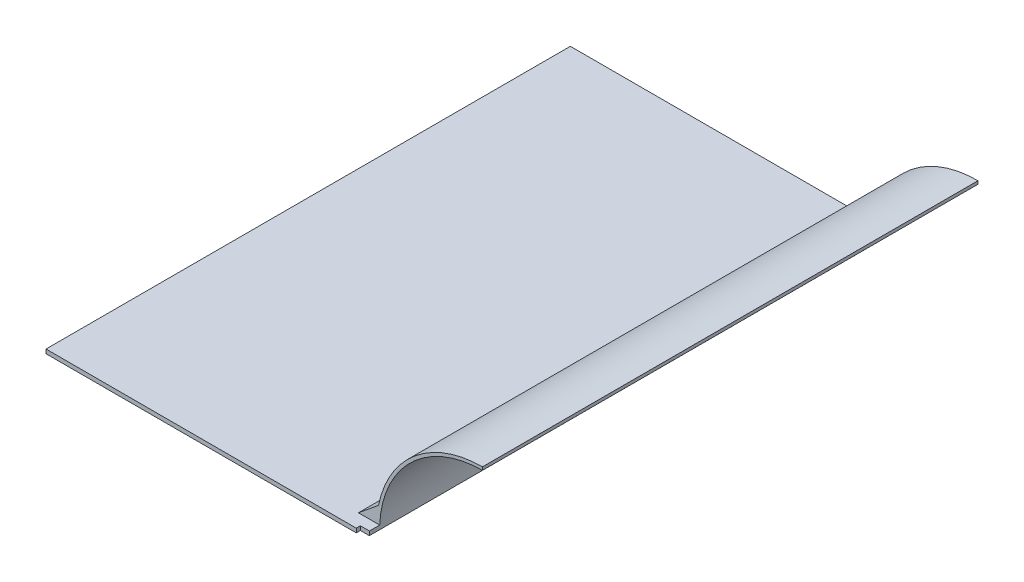
from build123d import *

# Parameters (mm, degrees)
BOSS_EXTRUDE1_DEPTH = 122.5
BOSS_EXTRUDE2_DEPTH = 5
FILLET1_R           = 0.6
BOSS_EXTRUDE3_DEPTH = 5
SKETCH6_W           = 154.900501524
SKETCH6_H           = 4.066396164
BOSS_EXTRUDE4_DEPTH = 5
CUT_EXTRUDE1_START  = -4
CUT_EXTRUDE1_DEPTH  = 4
BOSS_EXTRUDE5_START = 1
BOSS_EXTRUDE5_DEPTH = 1
SKETCH10_W          = 4
SKETCH10_H          = 2
CUT_EXTRUDE2_DEPTH  = 10
CUT_EXTRUDE3_DEPTH  = 1.066396
CUT_EXTRUDE5_DEPTH  = 1
CHAMFER1_START      = -123.5
CHAMFER1_DEPTH      = 247
SKETCH18_W          = 76.155383
SKETCH18_H          = 7
SKETCH18_W_2        = 77.788835
CUT_EXTRUDE6_DEPTH  = 60
BOSS_EXTRUDE6_START = 2
BOSS_EXTRUDE6_DEPTH = 2


with BuildPart() as part:
    # Sketch1 → Boss-Extrude1 (new, symmetric)
    with BuildSketch(Plane.XY):
        with BuildLine():
            Line((76.956830849, 0), (-76.956830849, 0))
            Line((-76.956830849, 0), (-76.956830849, -4.066396164))
            Line((-76.956830849, -4.066396164), (78.296976713, -4.066396164))
            ThreePointArc((78.296976713, -4.066396164), (92.937456554, 31.296585381), (128.296975316, 45.945426519))
            Line((128.296975316, 45.945426519), (128.296975316, 47.445426519))
            ThreePointArc((128.296975316, 47.445426519), (93.343867688, 33.767777941), (76.956830849, 0))
        make_face()
    extrude(amount=BOSS_EXTRUDE1_DEPTH, both=True)

    # Sketch4 → Boss-Extrude2 (add, symmetric)
    with BuildSketch(Plane.XY):
        Polygon((-75.056329325, -5), (-72.325824204, -5), (-71.690241182, -6.74625), (-71.191912346, -6.74625), (-70.556329325, -5), (-69.825824204, -5), (-69.190241182, -6.74625), (-68.691912346, -6.74625), (-68.056329325, -5), (-67.325824204, -5), (-66.690241182, -6.74625), (-66.191912346, -6.74625), (-65.556329325, -5), (-64.825824204, -5), (-64.190241182, -6.74625), (-63.691912346, -6.74625), (-63.056329325, -5), (-62.325824204, -5), (-61.690241182, -6.74625), (-61.191912346, -6.74625), (-60.556329325, -5), (-59.825824204, -5), (-59.190241182, -6.74625), (-58.691912346, -6.74625), (-58.056329325, -5), (-57.325824204, -5), (-56.690241182, -6.74625), (-56.191912346, -6.74625), (-55.556329325, -5), (-54.825824204, -5), (-54.190241182, -6.74625), (-53.691912346, -6.74625), (-53.056329325, -5), (-52.325824204, -5), (-51.690241182, -6.74625), (-51.191912346, -6.74625), (-50.556329325, -5), (-49.825824204, -5), (-49.190241182, -6.74625), (-48.691912346, -6.74625), (-48.056329325, -5), (-47.325824204, -5), (-46.690241182, -6.74625), (-46.191912346, -6.74625), (-45.556329325, -5), (-44.825824204, -5), (-44.190241182, -6.74625), (-43.691912346, -6.74625), (-43.056329325, -5), (-42.325824204, -5), (-41.690241182, -6.74625), (-41.191912346, -6.74625), (-40.556329325, -5), (-39.825824204, -5), (-39.190241182, -6.74625), (-38.691912346, -6.74625), (-38.056329325, -5), (-37.325824204, -5), (-36.690241182, -6.74625), (-36.191912346, -6.74625), (-35.556329325, -5), (-34.825824204, -5), (-34.190241182, -6.74625), (-33.691912346, -6.74625), (-33.056329325, -5), (-32.325824204, -5), (-31.690241182, -6.74625), (-31.191912346, -6.74625), (-30.556329325, -5), (-29.825824204, -5), (-29.190241182, -6.74625), (-28.691912346, -6.74625), (-28.056329325, -5), (-27.325824204, -5), (-26.690241182, -6.74625), (-26.191912346, -6.74625), (-25.556329325, -5), (-24.825824204, -5), (-24.190241182, -6.74625), (-23.691912346, -6.74625), (-23.056329325, -5), (-22.325824204, -5), (-21.690241182, -6.74625), (-21.191912346, -6.74625), (-20.556329325, -5), (-19.825824204, -5), (-19.190241182, -6.74625), (-18.691912346, -6.74625), (-18.056329325, -5), (-17.325824204, -5), (-16.690241182, -6.74625), (-16.191912346, -6.74625), (-15.556329325, -5), (-14.825824204, -5), (-14.190241182, -6.74625), (-13.691912346, -6.74625), (-13.056329325, -5), (-12.325824204, -5), (-11.690241182, -6.74625), (-11.191912346, -6.74625), (-10.556329325, -5), (-9.825824204, -5), (-9.190241182, -6.74625), (-8.691912346, -6.74625), (-8.056329325, -5), (-7.325824204, -5), (-6.690241182, -6.74625), (-6.191912346, -6.74625), (-5.556329325, -5), (-4.825824204, -5), (-4.190241182, -6.74625), (-3.691912346, -6.74625), (-3.056329325, -5), (-2.325824204, -5), (-1.690241182, -6.74625), (-1.191912346, -6.74625), (-0.556329325, -5), (0.174175796, -5), (0.809758818, -6.74625), (1.308087654, -6.74625), (1.943670675, -5), (2.674175796, -5), (3.309758818, -6.74625), (3.808087654, -6.74625), (4.443670675, -5), (5.174175796, -5), (5.809758818, -6.74625), (6.308087654, -6.74625), (6.943670675, -5), (7.674175796, -5), (8.309758818, -6.74625), (8.808087654, -6.74625), (9.443670675, -5), (10.174175796, -5), (10.809758818, -6.74625), (11.308087654, -6.74625), (11.943670675, -5), (12.674175796, -5), (13.309758818, -6.74625), (13.808087654, -6.74625), (14.443670675, -5), (15.174175796, -5), (15.809758818, -6.74625), (16.308087654, -6.74625), (16.943670675, -5), (17.674175796, -5), (18.309758818, -6.74625), (18.808087654, -6.74625), (19.443670675, -5), (20.174175796, -5), (20.809758818, -6.74625), (21.308087654, -6.74625), (21.943670675, -5), (22.674175796, -5), (23.309758818, -6.74625), (23.808087654, -6.74625), (24.443670675, -5), (25.174175796, -5), (25.809758818, -6.74625), (26.308087654, -6.74625), (26.943670675, -5), (27.674175796, -5), (28.309758818, -6.74625), (28.808087654, -6.74625), (29.443670675, -5), (30.174175796, -5), (30.809758818, -6.74625), (31.308087654, -6.74625), (31.943670675, -5), (32.674175796, -5), (33.309758818, -6.74625), (33.808087654, -6.74625), (34.443670675, -5), (35.174175796, -5), (35.809758818, -6.74625), (36.308087654, -6.74625), (36.943670675, -5), (37.674175796, -5), (38.309758818, -6.74625), (38.808087654, -6.74625), (39.443670675, -5), (40.174175796, -5), (40.809758818, -6.74625), (41.308087654, -6.74625), (41.943670675, -5), (42.674175796, -5), (43.309758818, -6.74625), (43.808087654, -6.74625), (44.443670675, -5), (45.174175796, -5), (45.809758818, -6.74625), (46.308087654, -6.74625), (46.943670675, -5), (47.674175796, -5), (48.309758818, -6.74625), (48.808087654, -6.74625), (49.443670675, -5), (50.174175796, -5), (50.809758818, -6.74625), (51.308087654, -6.74625), (51.943670675, -5), (52.674175796, -5), (53.309758818, -6.74625), (53.808087654, -6.74625), (54.443670675, -5), (55.174175796, -5), (55.809758818, -6.74625), (56.308087654, -6.74625), (56.943670675, -5), (57.674175796, -5), (58.309758818, -6.74625), (58.808087654, -6.74625), (59.443670675, -5), (60.174175796, -5), (60.809758818, -6.74625), (61.308087654, -6.74625), (61.943670675, -5), (62.674175796, -5), (63.309758818, -6.74625), (63.808087654, -6.74625), (64.443670675, -5), (65.174175796, -5), (65.809758818, -6.74625), (66.308087654, -6.74625), (66.943670675, -5), (67.674175796, -5), (68.309758818, -6.74625), (68.808087654, -6.74625), (69.443670675, -5), (70.174175796, -5), (70.809758818, -6.74625), (71.308087654, -6.74625), (71.943670675, -5), (71.943670675, -4.066396164), (-75.056329325, -4.066396164), align=None)
    extrude(amount=BOSS_EXTRUDE2_DEPTH, both=True)

    # Fillet1
    fillet1_edges = [part.edges().sort_by_distance(p)[0] for p in [
        (-1.556329325, -4.066396164, -5),
        (71.943670675, -4.066396164, 0),
        (-1.556329325, -4.066396164, 5),
    ]]
    fillet(fillet1_edges, radius=FILLET1_R)

    # Sketch5 → Boss-Extrude3 (add)
    with BuildSketch(Plane(origin=(0, 0, -122.5), x_dir=(-1, 0, 0), z_dir=(0, 0, -1))):
        with BuildLine():
            ThreePointArc((-128.296975316, 45.945426519), (-92.937456554, 31.296585381), (-78.296976713, -4.066396164))
            Line((-78.296976713, -4.066396164), (76.956830849, -4.066396164))
            Line((76.956830849, -4.066396164), (76.956830849, 0))
            Line((76.956830849, 0), (-76.956830849, 0))
            ThreePointArc((-76.956830849, 0), (-93.343867688, 33.767777941), (-128.296975316, 47.445426519))
            Line((-128.296975316, 47.445426519), (-128.296975316, 45.945426519))
        make_face()
    extrude(amount=BOSS_EXTRUDE3_DEPTH)

    # Sketch6 → Boss-Extrude4 (add)
    with BuildSketch(Plane.XY.offset(122.5)):
        with Locations((0.493419913, -2.033198082)):
            Rectangle(SKETCH6_W, SKETCH6_H)
    extrude(amount=BOSS_EXTRUDE4_DEPTH)

    # Sketch7 → Cut-Extrude1 (cut)
    with BuildSketch(Plane(origin=(0, 0, -127.5), x_dir=(-1, 0, 0), z_dir=(0, 0, -1)).offset(CUT_EXTRUDE1_START)):
        with BuildLine():
            Line((-78.461642128, 0), (-76.956830849, 0))
            ThreePointArc((-76.956830849, 0), (-93.343867688, 33.767777941), (-128.296975316, 47.445426519))
            Line((-128.296975316, 47.445426519), (-128.296975316, 45.945426519))
            ThreePointArc((-128.296975316, 45.945426519), (-94.405447422, 32.706334247), (-78.461642128, 0))
        make_face()
    extrude(amount=CUT_EXTRUDE1_DEPTH, mode=Mode.SUBTRACT)

    # Sketch8 → Boss-Extrude5 (add)
    with BuildSketch(Plane.XY.offset(122.5).offset(BOSS_EXTRUDE5_START)):
        with BuildLine():
            Line((76.956830849, 0), (77.943670675, 0))
            Line((77.943670675, 0), (77.943670675, -4.066396164))
            Line((77.943670675, -4.066396164), (78.296976713, -4.066396164))
            ThreePointArc((78.296976713, -4.066396164), (92.937456554, 31.296585381), (128.296975316, 45.945426519))
            Line((128.296975316, 45.945426519), (128.296975316, 47.445426519))
            ThreePointArc((128.296975316, 47.445426519), (93.343867688, 33.767777941), (76.956830849, 0))
        make_face()
    extrude(amount=-BOSS_EXTRUDE5_DEPTH)

    # Sketch10 → Cut-Extrude2 (cut)
    with BuildSketch(Plane.XZ.offset(4.066396164)):
        with Locations((75.943670675, 126.5)):
            Rectangle(SKETCH10_W, SKETCH10_H)
    extrude(amount=-CUT_EXTRUDE2_DEPTH, mode=Mode.SUBTRACT)

    # Sketch12 → Cut-Extrude3 (cut)
    with BuildSketch(Plane(origin=(0, 0, 0), x_dir=(1, 0, 0), z_dir=(0, 1, 0))):
        Polygon((73.943670675, -127.5), (73.943670675, -125.5), (77.943670675, -125.5), (77.943670675, -123.5), (76.956830849, -123.5), (76.956830849, 123.5), (78.461642128, 123.5), (78.461642128, 127.5), (-76.956830849, 127.5), (-76.956830849, -127.5), align=None)
    extrude(amount=-CUT_EXTRUDE3_DEPTH, mode=Mode.SUBTRACT)

    # Sketch16 → Cut-Extrude5 (cut)
    with BuildSketch(Plane(origin=(0, -1.066396, 0), x_dir=(1, 0, 0), z_dir=(0, 1, 0))):
        Polygon((78.386347236, 123.5), (78.386347236, 127.5), (-76.956830849, 127.5), (-76.956830849, -127.5), (73.943670675, -127.5), (73.943670675, -125.5), (77.943670675, -125.5), (77.943670675, -123.5), (76.956830849, -123.5), (76.956830849, 123.5), align=None)
    extrude(amount=-CUT_EXTRUDE5_DEPTH, mode=Mode.SUBTRACT)

    # Chamfer1: read off the stored shape, not the designer's step
    # Chamfer1 outline → Chamfer1 (add)
    with BuildSketch(Plane.XY.offset(CHAMFER1_START)):
        with BuildLine():
            Line((77.784888825, 5.984306849), (67.97671669, -2.066396))
            Line((67.97671669, -2.066396), (76.956830849, -2.066396))
            Line((76.956830849, -2.066396), (76.956830849, 0))
            ThreePointArc((76.956830849, 0), (77.283033889, 3.004306039), (77.784888825, 5.984306849))
        make_face()
    extrude(amount=CHAMFER1_DEPTH)

    # Sketch18 → Cut-Extrude6 (cut)
    with BuildSketch(Plane(origin=(0, -2.066396, 0), x_dir=(1, 0, 0), z_dir=(0, 1, 0))):
        with Locations((106.05440819, 124)):
            Rectangle(SKETCH18_W, SKETCH18_H)
        with Locations((106.87113419, -124)):
            Rectangle(SKETCH18_W_2, SKETCH18_H)
    extrude(amount=CUT_EXTRUDE6_DEPTH, mode=Mode.SUBTRACT)

    # Sketch19 → Boss-Extrude6 (add)
    with BuildSketch(Plane.XY.offset(123.5).offset(BOSS_EXTRUDE6_START)):
        with BuildLine():
            Line((78.33651945, -2.066396), (77.943670675, -2.066396))
            Line((77.943670675, -2.066396), (77.943670675, -4.066396164))
            Line((77.943670675, -4.066396164), (78.296976713, -4.066396164))
            ThreePointArc((78.296976713, -4.066396164), (78.306745125, -3.06619831), (78.33651945, -2.066396))
        make_face()
    extrude(amount=-BOSS_EXTRUDE6_DEPTH)


solid = part.part
